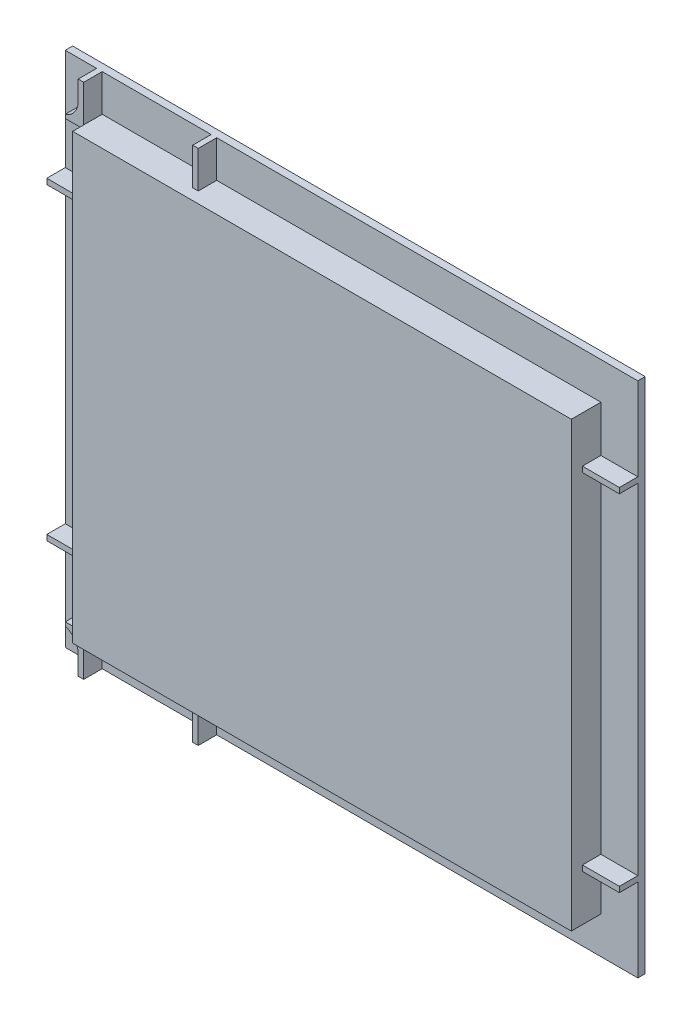
from build123d import *

# Parameters (mm, degrees)
SKETCH1_W                = 310
SKETCH1_H                = 280
SKETCH1_W_2              = 270
SKETCH1_H_2              = 240
BOSS_EXTRUDE1_DEPTH      = 4
BOSS_EXTRUDE3_DEPTH      = 16
BOSS_EXTRUDE3_DEPTH_BACK = 4
SKETCH2_W                = 270
SKETCH2_H                = 240
SKETCH2_W_2              = 263.25
SKETCH2_H_2              = 234
SKETCH4_W                = 263.25
SKETCH4_H                = 234
BOSS_EXTRUDE4_DEPTH      = 4
SKETCH6_W                = 20
SKETCH6_H                = 3
SKETCH6_W_2              = 10
SKETCH6_H_2              = 2
BOSS_EXTRUDE5_DEPTH      = 10
SKETCH7_W                = 3
SKETCH7_H                = 20
BOSS_EXTRUDE6_DEPTH      = 10
FILLET1_R                = 10


with BuildPart() as part:
    # Sketch1 → Boss-Extrude1 (new body)
    with BuildSketch(Plane.XY):
        Rectangle(SKETCH1_W, SKETCH1_H)
        Rectangle(SKETCH1_W_2, SKETCH1_H_2, mode=Mode.SUBTRACT)
    extrude(amount=BOSS_EXTRUDE1_DEPTH)

    # Sketch2 → Boss-Extrude3 (add, two sides: drawn at the far end of the back side and taken through both)
    with BuildSketch(Plane.XY.offset(4).offset(-BOSS_EXTRUDE3_DEPTH_BACK)):
        Rectangle(SKETCH2_W, SKETCH2_H)
        Rectangle(SKETCH2_W_2, SKETCH2_H_2, mode=Mode.SUBTRACT)
    extrude(amount=BOSS_EXTRUDE3_DEPTH + BOSS_EXTRUDE3_DEPTH_BACK)

    # Sketch4 → Boss-Extrude4 (add)
    with BuildSketch(Plane.XY.offset(20)):
        Rectangle(SKETCH4_W, SKETCH4_H)
    extrude(amount=-BOSS_EXTRUDE4_DEPTH)

    # Sketch6 → Boss-Extrude5 (add)
    with BuildSketch(Plane.XY.offset(4)):
        with Locations((-145, 83.5)):
            Rectangle(SKETCH6_W, SKETCH6_H)
        with Locations((145, 93.5)):
            Rectangle(SKETCH6_W, SKETCH6_H)
        with Locations((145, -93.5)):
            Rectangle(SKETCH6_W, SKETCH6_H)
        with Locations((-145, -83.5)):
            Rectangle(SKETCH6_W, SKETCH6_H)
        with Locations((-140, -119)):
            Rectangle(SKETCH6_W_2, SKETCH6_H_2)
        with Locations((-140, 119)):
            Rectangle(SKETCH6_W_2, SKETCH6_H_2)
    extrude(amount=BOSS_EXTRUDE5_DEPTH)

    # Sketch7 → Boss-Extrude6 (add)
    with BuildSketch(Plane.XY.offset(4)):
        with Locations((-136.5, 130)):
            Rectangle(SKETCH7_W, SKETCH7_H)
        with Locations((-74.5, 130)):
            Rectangle(SKETCH7_W, SKETCH7_H)
        with Locations((-136.5, -130)):
            Rectangle(SKETCH7_W, SKETCH7_H)
        with Locations((-74.5, -130)):
            Rectangle(SKETCH7_W, SKETCH7_H)
    extrude(amount=BOSS_EXTRUDE6_DEPTH)

    # Fillet1
    # the kernel refuses this fillet: 10 mm, written as the material it adds along each edge
    with BuildSketch(Plane(origin=(-138, -120, 4), x_dir=(-1, 0, 0), z_dir=(0, 0, 1))) as fillet1_piece_1:
        with BuildLine():
            CenterArc((10, 9.539392014), FILLET1_R, 180, 72.542396876)
            Line((0, 9.539392014), (-0.2, 9.539392014))
            Line((-0.2, 9.539392014), (-0.2, 0))
            Line((-0.2, 0), (0, -0.2))
            ThreePointArc((0, -0.2), (3.5, -0.2), (6.94, -0.19078784))
            Line((6.94, -0.19078784), (7, 0))
        make_face()
    extrude(amount=10)
    with BuildSketch(Plane(origin=(-138, 120, 4), x_dir=(0, 1, 0), z_dir=(0, 0, 1))) as fillet1_piece_2:
        with BuildLine():
            CenterArc((9.539392014, 10), FILLET1_R, 197.457603124, 72.542396876)
            Line((0, 7), (-0.19078784, 6.94))
            ThreePointArc((-0.19078784, 6.94), (-0.2, 3.5), (-0.2, 0))
            Line((-0.2, 0), (0, -0.2))
            Line((0, -0.2), (9.539392014, -0.2))
            Line((9.539392014, -0.2), (9.539392014, 0))
        make_face()
    extrude(amount=10)


solid = part.part
